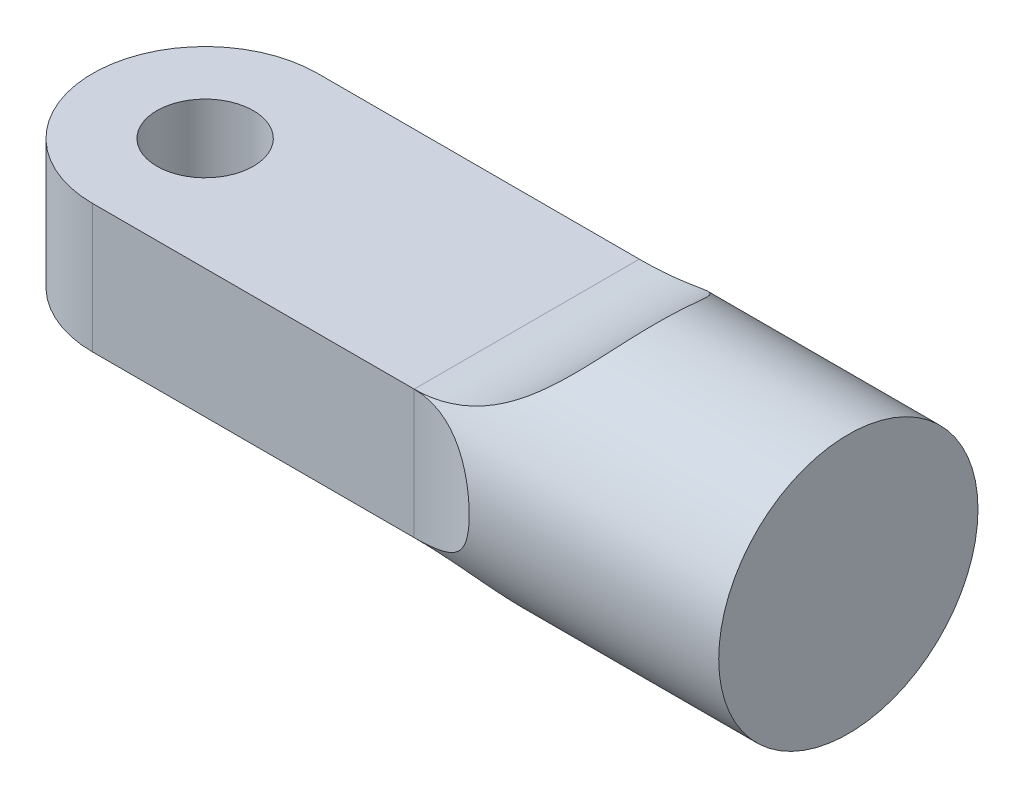
from build123d import *

# Parameters (mm, degrees)
SKETCH2_R           = 15
BOSS_EXTRUDE1_DEPTH = 20
SKETCH3_R           = 40.311288741
BOSS_EXTRUDE2_DEPTH = 50
FILLET1_R           = 50
FILLET2_R           = 50


with BuildPart() as part:
    # Sketch2 → Boss-Extrude1 (new, symmetric)
    with BuildSketch(Plane(origin=(0, 0, 0), x_dir=(1, 0, 0), z_dir=(0, 1, 0))):
        with BuildLine():
            Line((0, 35), (200, 35))
            Line((200, 35), (200, -35))
            Line((200, -35), (0, -35))
            ThreePointArc((0, -35), (-35, 0), (0, 35))
        make_face()
        with Locations(Location((0, 0, 0), (0, 0, 270))):
            Circle(SKETCH2_R, mode=Mode.SUBTRACT)
    extrude(amount=BOSS_EXTRUDE1_DEPTH, both=True)

    # Sketch3 → Boss-Extrude2 (add)
    with BuildSketch(Plane(origin=(200, 0, 0), x_dir=(0, 0, -1), z_dir=(1, 0, 0))):
        Circle(SKETCH3_R)
    extrude(amount=-BOSS_EXTRUDE2_DEPTH)

    # Fillet1
    # the kernel refuses this fillet: 50 mm, written as the material it adds along each edge
    with BuildSketch(Plane(origin=(150, -145, -35), x_dir=(-1, 0, 0), z_dir=(0, 1, 0))) as fillet1_piece_1_section:
        with BuildLine():
            CenterArc((FILLET1_R, -FILLET1_R), FILLET1_R, 90, 90)
            Line((0, -FILLET1_R), (0, 0))
            Line((0, 0), (FILLET1_R, 0))
        make_face()
    fillet1_piece_1 = extrude(amount=290, mode=Mode.PRIVATE)
    fillet1_piece_1 = fillet1_piece_1 & Plane(origin=(131.355668078, 0, 0), x_dir=(0, 0, -1), z_dir=(1, 0, 0)) * Cylinder(40.311288741, 781, mode=Mode.PRIVATE)
    add(fillet1_piece_1)
    with BuildSketch(Plane(origin=(150, 145, 35), x_dir=(0, 0, 1), z_dir=(0, -1, 0))) as fillet1_piece_2_section:
        with BuildLine():
            CenterArc((FILLET1_R, FILLET1_R), FILLET1_R, 180, 90)
            Line((0, FILLET1_R), (0, 0))
            Line((0, 0), (FILLET1_R, 0))
        make_face()
    fillet1_piece_2 = extrude(amount=290, mode=Mode.PRIVATE)
    fillet1_piece_2 = fillet1_piece_2 & Plane(origin=(131.35565772, 0, 0), x_dir=(0, 0, -1), z_dir=(1, 0, 0)) * Cylinder(40.311288741, 780, mode=Mode.PRIVATE)
    add(fillet1_piece_2)

    # Fillet2
    # the kernel refuses this fillet: 50 mm, written as the material it adds along each edge
    with BuildSketch(Plane(origin=(150, -20, -160), x_dir=(-1, 0, 0), z_dir=(0, 0, 1))) as fillet2_piece_1_section:
        with BuildLine():
            CenterArc((FILLET2_R, FILLET2_R), FILLET2_R, 180, 90)
            Line((0, FILLET2_R), (0, 0))
            Line((0, 0), (FILLET2_R, 0))
        make_face()
    fillet2_piece_1 = extrude(amount=320, mode=Mode.PRIVATE)
    fillet2_piece_1 = fillet2_piece_1 & Plane(origin=(135.236587788, 0, 0), x_dir=(0, 0, -1), z_dir=(1, 0, 0)) * Cylinder(40.311288741, 840, mode=Mode.PRIVATE)
    add(fillet2_piece_1)
    with BuildSketch(Plane(origin=(150, 20, -160), x_dir=(-1, 0, 0), z_dir=(0, 0, 1))) as fillet2_piece_2_section:
        with BuildLine():
            CenterArc((FILLET2_R, -FILLET2_R), FILLET2_R, 90, 90)
            Line((0, -FILLET2_R), (0, 0))
            Line((0, 0), (FILLET2_R, 0))
        make_face()
    fillet2_piece_2 = extrude(amount=320, mode=Mode.PRIVATE)
    fillet2_piece_2 = fillet2_piece_2 & Plane(origin=(135.236587787, 0, 0), x_dir=(0, 0, -1), z_dir=(1, 0, 0)) * Cylinder(40.311288741, 840, mode=Mode.PRIVATE)
    add(fillet2_piece_2)


solid = part.part
